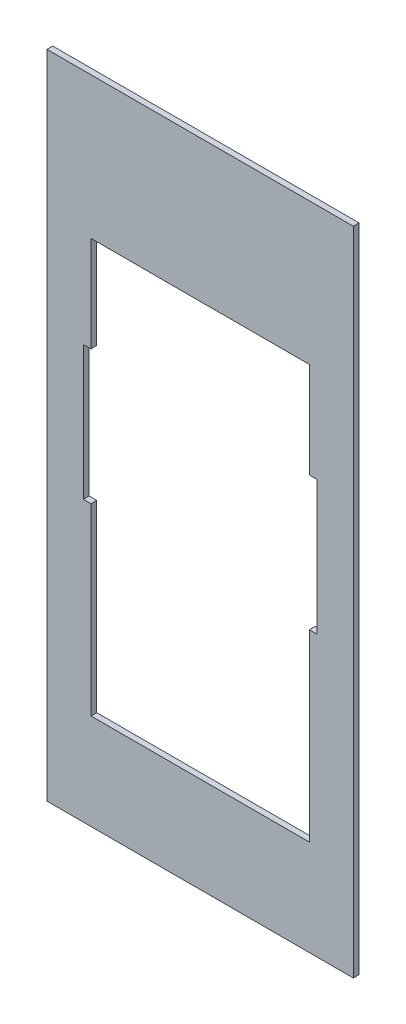
from build123d import *

# Parameters (mm, degrees)
SKETCH1_W           = 80
SKETCH1_H           = 170
BOSS_EXTRUDE1_DEPTH = 1.5


with BuildPart() as part:
    # Sketch1 → Boss-Extrude1 (new body)
    with BuildSketch(Plane.XY):
        Rectangle(SKETCH1_W, SKETCH1_H)
        Polygon((-28.5, -12), (-28.5, -60), (28.5, -60), (28.5, -12), (30.5, -12), (30.5, 23), (28.5, 23), (28.5, 48), (-28.5, 48), (-28.5, 23), (-30.5, 23), (-30.5, -12), align=None, mode=Mode.SUBTRACT)
    extrude(amount=BOSS_EXTRUDE1_DEPTH)


solid = part.part
